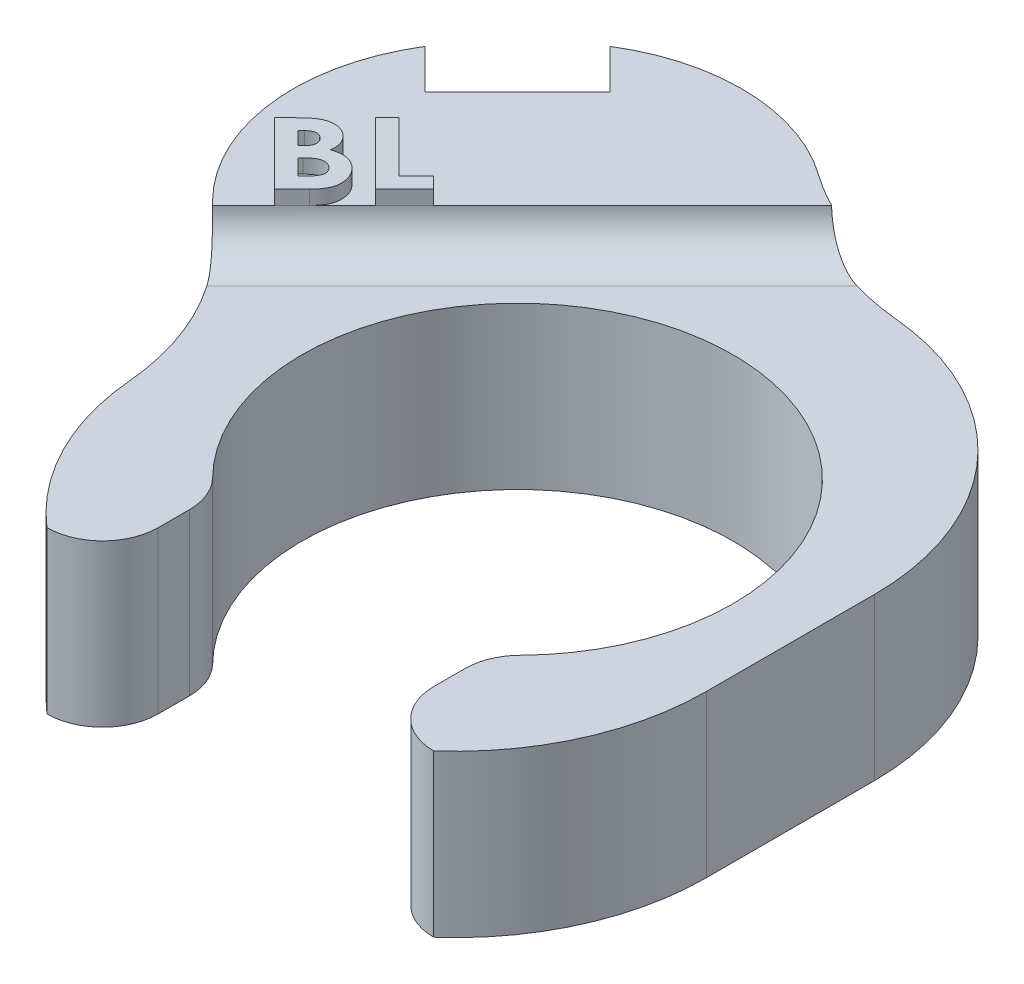
from build123d import *

# Parameters (mm, degrees)
BOSS_EXTRUDE1_DEPTH     = 5.8
BOSS_EXTRUDE2_START     = -5.8
BOSS_EXTRUDE2_DEPTH     = 5.8
BOSS_EXTRUDE3_DEPTH     = 4.5
CUT_EXTRUDE1_DEPTH      = 26.767293083
CUT_EXTRUDE1_DEPTH_BACK = 26.767293083
FILLET6_R               = 7
FILLET7_R               = 7
FILLET8_R               = 9
FILLET9_R               = 9
FILLET10_R              = 9
FILLET11_R              = 9
FILLET12_DEPTH          = 5.8
FILLET13_R              = 1.5
SKETCH11_W              = 22.477586639
SKETCH11_H              = 16.715029759
CUT_EXTRUDE3_DEPTH      = 3.048
BOSS_EXTRUDE4_DEPTH     = 0.508


with BuildPart() as part:
    # Sketch1 → Boss-Extrude1 (new body)
    with BuildSketch(Plane(origin=(0, 0, 0), x_dir=(1, 0, 0), z_dir=(0, 1, 0))):
        with BuildLine():
            Line((10, 12.25), (-10, 12.25))
            Line((-10, 12.25), (-10, -7.463220606))
            Line((-10, -7.463220606), (-10, -9.463220606))
            Line((-10, -9.463220606), (-8, -9.463220606))
            Line((-8, -9.463220606), (-6.95, -9.463220606))
            ThreePointArc((-6.95, -9.463220606), (-5.535786438, -8.877434169), (-4.95, -7.463220606))
            Line((-4.95, -7.463220606), (-4.95, -6.338128399))
            ThreePointArc((-4.95, -6.338128399), (-5.099151269, -5.580263652), (-5.524358974, -4.935435394))
            ThreePointArc((-5.524358974, -4.935435394), (0, 8.25), (5.524358974, -4.935435394))
            ThreePointArc((5.524358974, -4.935435394), (5.099151269, -5.580263652), (4.95, -6.338128399))
            Line((4.95, -6.338128399), (4.95, -7.463220606))
            ThreePointArc((4.95, -7.463220606), (5.535786438, -8.877434169), (6.95, -9.463220606))
            Line((6.95, -9.463220606), (8, -9.463220606))
            Line((8, -9.463220606), (10, -9.463220606))
            Line((10, -9.463220606), (10, -7.463220606))
            Line((10, -7.463220606), (10, 12.25))
        make_face()
    extrude(amount=BOSS_EXTRUDE1_DEPTH)

    # Sketch5 → Boss-Extrude2 (add)
    with BuildSketch(Plane(origin=(0, 5.8, 0), x_dir=(1, 0, 0), z_dir=(0, 1, 0)).offset(BOSS_EXTRUDE2_START)):
        with BuildLine():
            Line((5.480077554, 5.980077554), (-6.540737726, 18.000892834))
            Line((-6.540737726, 18.000892834), (-17.500892834, 7.040737726))
            Line((-17.500892834, 7.040737726), (-5.480077554, -4.980077554))
            ThreePointArc((-5.480077554, -4.980077554), (-5.480077554, 5.980077554), (5.480077554, 5.980077554))
        make_face()
    extrude(amount=BOSS_EXTRUDE2_DEPTH)

    # Sketch7 → Boss-Extrude3 (add)
    with BuildSketch(Plane(origin=(0, 5.8, 0), x_dir=(1, 0, 0), z_dir=(0, 1, 0))):
        Polygon((-1.590990258, 13.051145366), (-6.540737726, 18.000892834), (-17.500892834, 7.040737726), (-12.551145366, 2.090990258), align=None)
    extrude(amount=BOSS_EXTRUDE3_DEPTH)

    # Sketch8 → Cut-Extrude1 (cut, two sides: drawn at the far end of the back side and taken through both)
    with BuildSketch(Plane(origin=(0, 5.8, 0), x_dir=(1, 0, 0), z_dir=(0, 1, 0)).offset(-CUT_EXTRUDE1_DEPTH_BACK)):
        Polygon((-10.359114344, 14.182516216), (-8.944900782, 12.768302654), (-12.268302654, 9.444900782), (-13.682516216, 10.859114344), align=None)
    extrude(amount=CUT_EXTRUDE1_DEPTH + CUT_EXTRUDE1_DEPTH_BACK, mode=Mode.SUBTRACT)

    # Fillet6
    # the kernel refuses this fillet: 7 mm, written as the material it takes off along each edge
    with BuildSketch(Plane(origin=(-17.500892834, -17.036725037, -7.040737726), x_dir=(0.7071067811865471, 0, 0.707106781186548), z_dir=(0, 1, 0))) as fillet6_piece_1:
        with BuildLine():
            CenterArc((6.814690015, 7), FILLET6_R, 193.21298036, 76.78701964)
            Line((0, 5.4), (-0.1362938, 5.368))
            ThreePointArc((-0.1362938, 5.368), (-0.14, 2.7), (-0.14, 0))
            Line((-0.14, 0), (0, -0.14))
            Line((0, -0.14), (6.814690015, -0.14))
            Line((6.814690015, -0.14), (6.814690015, 0))
        make_face()
    extrude(amount=44.373450075, mode=Mode.SUBTRACT)

    # Fillet7
    # the kernel refuses this fillet: 7 mm, written as the material it takes off along each edge
    with BuildSketch(Plane(origin=(-6.540737726, -17.036725037, -18.000892834), x_dir=(-0.7071067811865467, 0, 0.7071067811865485), z_dir=(0, 1, 0))) as fillet7_piece_1:
        with BuildLine():
            CenterArc((7, 6.814690015), FILLET7_R, 180, 76.78701964)
            Line((0, 6.814690015), (-0.14, 6.814690015))
            Line((-0.14, 6.814690015), (-0.14, 0))
            Line((-0.14, 0), (0, -0.14))
            ThreePointArc((0, -0.14), (2.7, -0.14), (5.368, -0.1362938))
            Line((5.368, -0.1362938), (5.4, 0))
        make_face()
    extrude(amount=44.373450075, mode=Mode.SUBTRACT)

    # Fillet8
    # the kernel refuses this fillet: 9 mm, written as the material it adds along each edge
    with BuildSketch(Plane(origin=(-0.789844892, 14.352294771, -12.25), x_dir=(-0.7337802799425581, 0, -0.6793868564870981), z_dir=(0, -1, 0))) as fillet8_piece_1_section:
        with BuildLine():
            CenterArc((3.604279608, 8.928149184), FILLET8_R, 227.204251593, 35.551028785)
            Line((-2.510202101, 2.324126664), (-3.121650271, 1.663724412))
            Line((-3.121650271, 1.663724412), (-0.611448171, -0.660402252))
            Line((-0.611448171, -0.660402252), (0.034615763, -0.899334059))
            ThreePointArc((0.034615763, -0.899334059), (1.351940933, -0.848629634), (2.355814908, -0.892814918))
            Line((2.355814908, -0.892814918), (2.469311699, 0))
        make_face()
    fillet8_piece_1 = extrude(amount=14.352294771, mode=Mode.PRIVATE)
    fillet8_piece_1 = split(fillet8_piece_1, bisect_by=Plane(origin=(-0.789844892, 5.8, -12.25), z_dir=(0, 1, 0)), keep=Keep.TOP, mode=Mode.PRIVATE)
    fillet8_piece_1 = split(fillet8_piece_1, bisect_by=Plane(origin=(-0.789844892, 10.3, -12.25), z_dir=(0, -1, 0)), keep=Keep.TOP, mode=Mode.PRIVATE)
    fillet8_piece_1 = split(fillet8_piece_1, bisect_by=Plane(origin=(-1.590990258, 14.352294771, -13.051145366), z_dir=(-0.7071067811865475, 0, -0.7071067811865476)), keep=Keep.TOP, mode=Mode.PRIVATE)
    add(fillet8_piece_1)
    with BuildSketch(Plane(origin=(-0.789844892, 5.8, -12.25), x_dir=(-0.7337802799425581, 0, -0.6793868564870981), z_dir=(0, -1, 0))) as fillet8_piece_2_section:
        with BuildLine():
            CenterArc((3.604279608, 8.928149184), FILLET8_R, 227.204251593, 35.551028785)
            Line((-2.510202101, 2.324126664), (-3.121650271, 1.663724412))
            Line((-3.121650271, 1.663724412), (-0.611448171, -0.660402252))
            Line((-0.611448171, -0.660402252), (0.034615763, -0.899334059))
            ThreePointArc((0.034615763, -0.899334059), (1.351940933, -0.848629634), (2.355814908, -0.892814918))
            Line((2.355814908, -0.892814918), (2.469311699, 0))
        make_face()
    fillet8_piece_2 = extrude(amount=5.8, mode=Mode.PRIVATE)
    fillet8_piece_2 = split(fillet8_piece_2, bisect_by=Plane(origin=(-1.590990258, 5.8, -13.051145366), z_dir=(-0.7071067811865475, 0, -0.7071067811865476)), keep=Keep.TOP, mode=Mode.PRIVATE)
    add(fillet8_piece_2)
    with BuildSketch(Plane(origin=(-0.789844892, 5.8, -12.25), x_dir=(-0.7337802799425581, 0, -0.6793868564870981), z_dir=(0, -1, 0))) as fillet8_piece_3_section:
        with BuildLine():
            CenterArc((3.604279608, 8.928149184), FILLET8_R, 227.204251593, 35.551028785)
            Line((-2.510202101, 2.324126664), (-3.121650271, 1.663724412))
            Line((-3.121650271, 1.663724412), (-0.611448171, -0.660402252))
            Line((-0.611448171, -0.660402252), (0.034615763, -0.899334059))
            ThreePointArc((0.034615763, -0.899334059), (1.351940933, -0.848629634), (2.355814908, -0.892814918))
            Line((2.355814908, -0.892814918), (2.469311699, 0))
        make_face()
    fillet8_piece_3 = extrude(amount=5.8, mode=Mode.PRIVATE)
    fillet8_piece_3 = split(fillet8_piece_3, bisect_by=Plane(origin=(-1.590990258, 5.8, -13.051145366), z_dir=(0.7071067811865475, 0, 0.7071067811865476)), keep=Keep.TOP, mode=Mode.PRIVATE)
    add(fillet8_piece_3)

    # Fillet9
    fillet9_edges = [part.edges().sort_by_distance(p)[0] for p in [
        (10, 2.9, -12.25),
    ]]
    fillet(fillet9_edges, radius=FILLET9_R)

    # Fillet10
    fillet10_edges = [part.edges().sort_by_distance(p)[0] for p in [
        (-10, 2.9, 0.460155108),
    ]]
    fillet(fillet10_edges, radius=FILLET10_R)

    # Fillet11
    # the kernel refuses this fillet: 9 mm, written as the material it takes off along each edge
    with BuildSketch(Plane(origin=(10, -16.881480237, 9.463220606), x_dir=(0, 0, -1), z_dir=(0, 1, 0))) as fillet11_piece_1:
        with BuildLine():
            CenterArc((6.752592095, 9), FILLET11_R, 221.384667587, 48.615332413)
            Line((0, 3.05), (0, 0))
            Line((0, 0), (6.752592095, 0))
        make_face()
    extrude(amount=39.562960474, mode=Mode.SUBTRACT)

    # Fillet12: read off the stored shape, not the designer's step
    # Fillet12 outline → Fillet12 (cut)
    with BuildSketch(Plane(origin=(0, 0, 0), x_dir=(1, 0, 0), z_dir=(0, 1, 0))):
        with BuildLine():
            Line((-10, -9.463220606), (-6.95, -9.463220606))
            ThreePointArc((-6.95, -9.463220606), (-9.082460071, -6.743546791), (-10.032769562, -3.42075828))
            ThreePointArc((-10.032769562, -3.42075828), (-10.008196123, -3.804068015), (-10, -4.18807717))
            Line((-10, -4.18807717), (-10, -9.463220606))
        make_face()
    extrude(amount=FILLET12_DEPTH, mode=Mode.SUBTRACT)

    # Fillet13
    fillet13_edges = [part.edges().sort_by_distance(p)[0] for p in [
        (-6.988797537, 5.8, -7.653338087),
    ]]
    fillet(fillet13_edges, radius=FILLET13_R)

    # Sketch11 → Cut-Extrude3 (cut)
    with BuildSketch(Plane(origin=(0, 10.3, 0), x_dir=(1, 0, 0), z_dir=(0, 1, 0))):
        with Locations((-8.183279801, 8.85751488)):
            Rectangle(SKETCH11_W, SKETCH11_H)
    extrude(amount=-CUT_EXTRUDE3_DEPTH, mode=Mode.SUBTRACT)

    # Sketch12 → Boss-Extrude4 (add)
    # profile 1 of 2: a face of its own
    with BuildSketch(Plane(origin=(0, 7.252, 0), x_dir=(1, 0, 0), z_dir=(0, 1, 0))):
        with BuildLine():
            Line((-11.433918494, 3.207130735), (-13.656164087, 5.429376328))
            Line((-13.656164087, 5.429376328), (-13.306990409, 5.778550006))
            add(Edge.make_bspline(
                [(-13.306990409, 5.778550006), (-13.282454925, 5.802776429), (-13.234978761, 5.849654556), (-13.165425965, 5.916476582), (-13.098874205, 5.976521512), (-13.036503263, 6.030151615), (-12.978079516, 6.077802204), (-12.923873082, 6.119198581), (-12.872751416, 6.153785376), (-12.839393353, 6.173658456), (-12.823617012, 6.183057218)],
                knots=[0, 0, 0, 0, 1.309509407, 2.53390071, 3.662611673, 4.713207521, 5.65757546, 6.525538268, 7.302669039, 8, 8, 8, 8], degree=3))
            add(Edge.make_bspline(
                [(-12.823617012, 6.183057218), (-12.802788726, 6.194609559), (-12.761621022, 6.217443093), (-12.697895295, 6.245762593), (-12.634133803, 6.269757801), (-12.56983835, 6.287547266), (-12.505336684, 6.299591985), (-12.440703357, 6.30663579), (-12.375602361, 6.30874407), (-12.310534388, 6.304682079), (-12.246186103, 6.296126998), (-12.183706133, 6.281210456), (-12.123192616, 6.26165718), (-12.064977726, 6.236536624), (-12.008583815, 6.206665212), (-11.954657564, 6.170648612), (-11.90197945, 6.130230589), (-11.86992907, 6.099017275), (-11.853690129, 6.08320245)],
                knots=[0, 0, 0, 0, 1.084350962, 2.143250767, 3.172862443, 4.184936649, 5.177333569, 6.158390596, 7.143762693, 8.140051288, 9.124666062, 10.096699818, 11.061657142, 12.017683079, 12.981044671, 13.963953334, 14.96839786, 16, 16, 16, 16], degree=3))
            add(Edge.make_bspline(
                [(-11.853690129, 6.08320245), (-11.833695098, 6.061786816), (-11.794496473, 6.019803215), (-11.744824985, 5.950445998), (-11.706053697, 5.876556968), (-11.675627227, 5.798838873), (-11.654783836, 5.715764393), (-11.646075384, 5.626358621), (-11.645711155, 5.530411251), (-11.653667868, 5.464730746), (-11.657796699, 5.430648363)],
                knots=[0, 0, 0, 0, 0.99067682, 1.942141011, 2.875945802, 3.80710181, 4.760510965, 5.763396677, 6.839400355, 8, 8, 8, 8], degree=3))
            add(Edge.make_bspline(
                [(-11.657796699, 5.430648363), (-11.633275636, 5.438929098), (-11.585409595, 5.455093403), (-11.51376359, 5.47510442), (-11.443865679, 5.489816624), (-11.375836479, 5.499196125), (-11.310000456, 5.504659461), (-11.245981468, 5.504624925), (-11.183832662, 5.499731758), (-11.123495787, 5.489260877), (-11.064806043, 5.474646149), (-11.007384688, 5.455511461), (-10.951320622, 5.43180242), (-10.896328629, 5.404097033), (-10.843692728, 5.370224131), (-10.791123294, 5.333853803), (-10.74086075, 5.291293515), (-10.708700331, 5.26057519), (-10.69232194, 5.244931216)],
                knots=[0, 0, 0, 0, 1.186823522, 2.316724293, 3.409365292, 4.459881737, 5.464350107, 6.43663382, 7.392641392, 8.319733159, 9.241763701, 10.164153021, 11.092314833, 12.031563043, 12.983855256, 13.960407647, 14.961293332, 16, 16, 16, 16], degree=3))
            add(Edge.make_bspline(
                [(-10.69232194, 5.244931216), (-10.662711688, 5.213086008), (-10.604388694, 5.150360848), (-10.534792676, 5.043187191), (-10.481250771, 4.928657287), (-10.444886915, 4.807724635), (-10.424665152, 4.684555752), (-10.42025279, 4.562136178), (-10.433983306, 4.442477202), (-10.458824615, 4.344796), (-10.488499119, 4.267905532), (-10.516741098, 4.208703935), (-10.550346141, 4.148121342), (-10.591037263, 4.086860175), (-10.63742873, 4.02412579), (-10.689537148, 3.959947573), (-10.747842318, 3.894725101), (-10.789674593, 3.851891338), (-10.811257236, 3.829791993)],
                knots=[0, 0, 0, 0, 1.298883416, 2.558396595, 3.804036434, 5.070048068, 6.323350088, 7.528998892, 8.722475042, 9.914652862, 10.533024677, 11.18554826, 11.875496583, 12.603763947, 13.383899814, 14.209016025, 15.075972575, 16, 16, 16, 16], degree=3))
            Line((-10.811257236, 3.829791993), (-11.433918494, 3.207130735))
        make_face()
        with BuildLine():
            Line((-12.829977188, 5.449092875), (-12.361232196, 4.980347883))
            Line((-12.361232196, 4.980347883), (-12.26900964, 5.072570439))
            add(Edge.make_bspline(
                [(-12.26900964, 5.072570439), (-12.245547401, 5.097363095), (-12.201564855, 5.143839654), (-12.151000295, 5.219166085), (-12.11755893, 5.292596724), (-12.102877282, 5.364895711), (-12.105448894, 5.434609358), (-12.123760352, 5.500941866), (-12.1576345, 5.563715502), (-12.190341519, 5.599214265), (-12.20731593, 5.617637546)],
                knots=[0, 0, 0, 0, 1.313990156, 2.46321901, 3.480591621, 4.405417619, 5.280516781, 6.144979895, 7.037274703, 8, 8, 8, 8], degree=3))
            add(Edge.make_bspline(
                [(-12.20731593, 5.617637546), (-12.224715574, 5.633514603), (-12.258139887, 5.664014062), (-12.317275844, 5.695374701), (-12.379628221, 5.712252715), (-12.445412797, 5.71505704), (-12.513687531, 5.700774859), (-12.583309359, 5.669718369), (-12.654035915, 5.621389649), (-12.697848327, 5.57995397), (-12.721218174, 5.557851889)],
                knots=[0, 0, 0, 0, 0.960673721, 1.845431933, 2.708145215, 3.584916116, 4.513733637, 5.535401244, 6.685365794, 8, 8, 8, 8], degree=3))
            Line((-12.721218174, 5.557851889), (-12.829977188, 5.449092875))
        make_face(mode=Mode.SUBTRACT)
        with BuildLine():
            Line((-11.984073743, 4.603189429), (-11.414201948, 4.033317634))
            Line((-11.414201948, 4.033317634), (-11.308623022, 4.13889656))
            add(Edge.make_bspline(
                [(-11.308623022, 4.13889656), (-11.287651539, 4.160125932), (-11.24747336, 4.200798187), (-11.193005753, 4.261936492), (-11.145174295, 4.319119162), (-11.106056354, 4.373922053), (-11.07299492, 4.424655747), (-11.047992974, 4.472337233), (-11.030214568, 4.516833005), (-11.019635078, 4.558588812), (-11.016079733, 4.598440863), (-11.016373314, 4.636687691), (-11.022252608, 4.674146416), (-11.033171282, 4.710421862), (-11.04875569, 4.745741652), (-11.068410481, 4.780342887), (-11.093612184, 4.813514625), (-11.112963719, 4.834232165), (-11.122905874, 4.844876128)],
                knots=[0, 0, 0, 0, 1.721434749, 3.298007816, 4.723251275, 6.020090977, 7.180600004, 8.214633596, 9.120969771, 9.939793866, 10.689556408, 11.423587917, 12.141543794, 12.869125978, 13.603157487, 14.364799764, 15.159890143, 16, 16, 16, 16], degree=3))
            add(Edge.make_bspline(
                [(-11.122905874, 4.844876128), (-11.134742573, 4.856193135), (-11.157993871, 4.878423583), (-11.196466572, 4.906178829), (-11.235979242, 4.929767363), (-11.277807887, 4.946541189), (-11.320437005, 4.959748589), (-11.364765118, 4.966796848), (-11.410425135, 4.967539842), (-11.45764275, 4.96486473), (-11.506603908, 4.95497), (-11.557098065, 4.938110069), (-11.609405881, 4.914253737), (-11.663559766, 4.883449423), (-11.719510391, 4.845612711), (-11.777580747, 4.801132935), (-11.836446723, 4.748415198), (-11.875856498, 4.710586414), (-11.89630331, 4.690959862)],
                knots=[0, 0, 0, 0, 0.878469438, 1.725612497, 2.541894601, 3.343271312, 4.139373348, 4.934905255, 5.743608715, 6.588069601, 7.470073549, 8.417002956, 9.441270676, 10.552701352, 11.758991805, 13.066164284, 14.47785003, 16, 16, 16, 16], degree=3))
            Line((-11.89630331, 4.690959862), (-11.984073743, 4.603189429))
        make_face(mode=Mode.SUBTRACT)
    # profile 2 of 2: a face of its own
    with BuildSketch(Plane(origin=(0, 7.252, 0), x_dir=(1, 0, 0), z_dir=(0, 1, 0))):
        Polygon((-11.84284314, 7.242697276), (-11.419891417, 7.665648998), (-9.600881, 5.846638582), (-8.984579919, 6.462939663), (-8.581344742, 6.059704487), (-9.620597547, 5.020451683), align=None)
    extrude(amount=BOSS_EXTRUDE4_DEPTH)


solid = part.part
